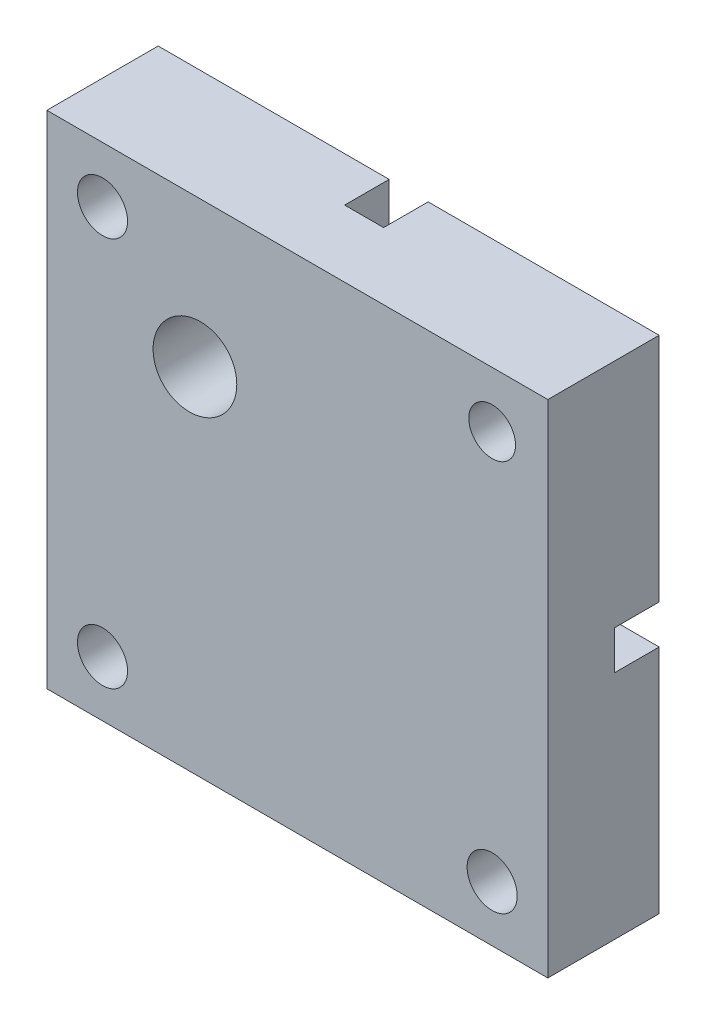
from build123d import *

# Parameters (mm, degrees)
SKETCH1_W           = 45
SKETCH1_H           = 45
SKETCH1_R           = 2.25
SKETCH1_R_2         = 2.1
SKETCH1_RX          = 4
SKETCH1_RY          = 3.5
BOSS_EXTRUDE1_DEPTH = 10
CUT_EXTRUDE1_DEPTH  = 5
CUT_EXTRUDE2_DEPTH  = 4


with BuildPart() as part:
    # Sketch1 → Boss-Extrude1 (new body)
    with BuildSketch(Plane.XY):
        with Locations((22.5, 22.5)):
            Rectangle(SKETCH1_W, SKETCH1_H)
        with Locations((5, 5)):
            Circle(SKETCH1_R, mode=Mode.SUBTRACT)
        with Locations((5, 40)):
            Circle(SKETCH1_R, mode=Mode.SUBTRACT)
        with Locations((40, 40)):
            Circle(SKETCH1_R_2, mode=Mode.SUBTRACT)
        with Locations((40, 5)):
            Circle(SKETCH1_R, mode=Mode.SUBTRACT)
        with Locations(Location((13.301788415, 31.698211585), (0, 0, 45))):
            Ellipse(SKETCH1_RX, SKETCH1_RY, mode=Mode.SUBTRACT)
    extrude(amount=BOSS_EXTRUDE1_DEPTH)

    # Sketch2 → Cut-Extrude1 (cut)
    with BuildSketch(Plane.XY):
        Polygon((8.75277675, 5), (6.876388375, 8.25), (3.123611625, 8.25), (1.24722325, 5), (3.123611625, 1.75), (6.876388375, 1.75), align=None)
        Polygon((8.75277675, 40), (6.876388375, 43.25), (3.123611625, 43.25), (1.24722325, 40), (3.123611625, 36.75), (6.876388375, 36.75), align=None)
        Polygon((43.75277675, 40), (41.876388375, 43.25), (38.123611625, 43.25), (36.24722325, 40), (38.123611625, 36.75), (41.876388375, 36.75), align=None)
        Polygon((43.75277675, 5), (41.876388375, 8.25), (38.123611625, 8.25), (36.24722325, 5), (38.123611625, 1.75), (41.876388375, 1.75), align=None)
    extrude(amount=CUT_EXTRUDE1_DEPTH, mode=Mode.SUBTRACT)

    # Sketch3 → Cut-Extrude2 (cut)
    with BuildSketch(Plane(origin=(0, 0, 0), x_dir=(-1, 0, 0), z_dir=(0, 0, -1))):
        Polygon((-45, 24.25), (-24.25, 24.25), (-24.25, 45), (-20.75, 45), (-20.75, 24.25), (0, 24.25), (0, 20.75), (-20.75, 20.75), (-20.75, 0), (-24.25, 0), (-24.25, 20.75), (-45, 20.75), align=None)
    extrude(amount=-CUT_EXTRUDE2_DEPTH, mode=Mode.SUBTRACT)


solid = part.part
